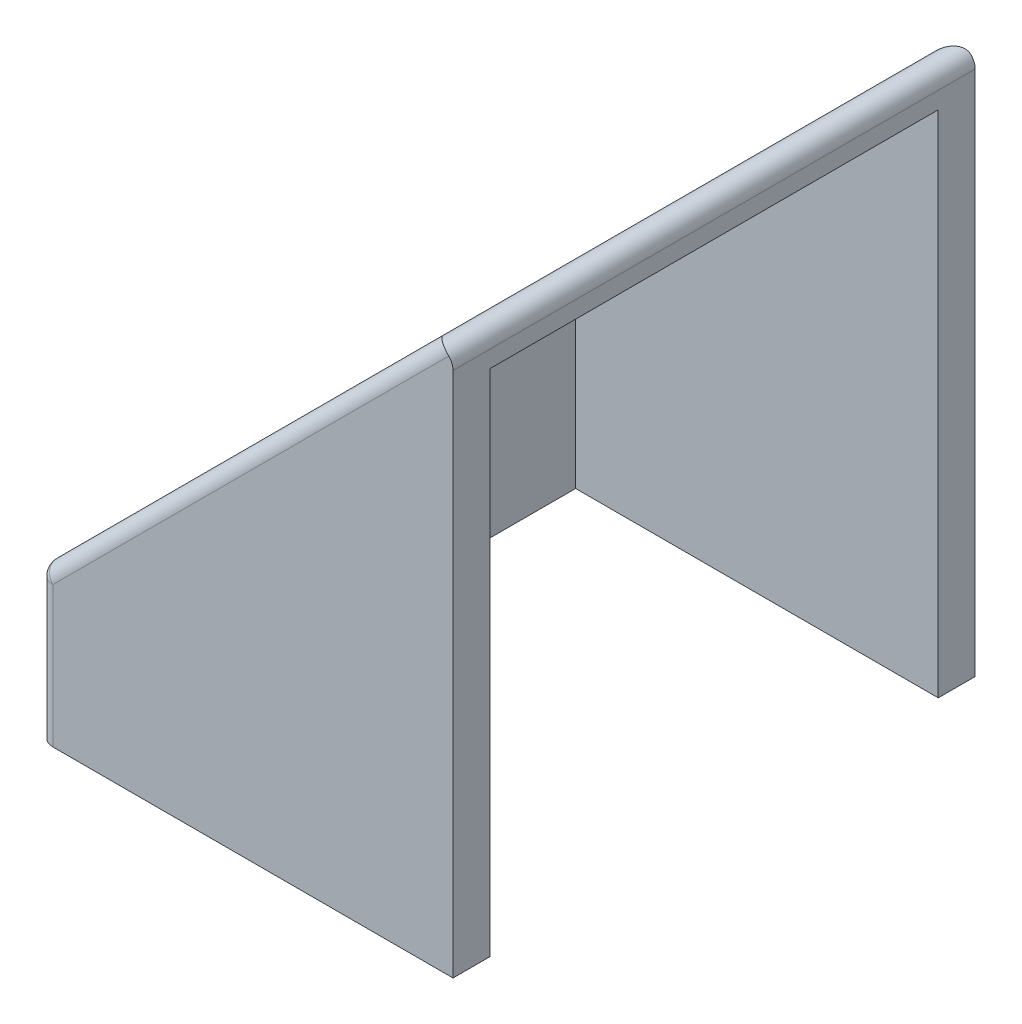
from build123d import *

# Parameters (mm, degrees)
BOSS_EXTRUDE1_DEPTH              = 22.606
CUT_EXTRUDE1_REACH               = 37.603
CUT_EXTRUDE1_OFFSET_FROM_SURFACE = 1.6
SKETCH2_W                        = 19.406
SKETCH2_H                        = 16.360512242
BOSS_EXTRUDE2_DEPTH              = 6.35
FILLET1_R                        = 0.635


with BuildPart() as part:
    # Sketch1 → Boss-Extrude1 (new body)
    with BuildSketch(Plane.XY):
        Polygon((0, 0), (17.960512242, 17.960512242), (17.960512242, 0), align=None)
    extrude(amount=BOSS_EXTRUDE1_DEPTH)

    # Cut-Extrude1: up to this face of the body (flat: up to its plane, moved by the offset)
    cut_extrude1_end = Plane(part.part.faces().sort_by_distance((8.980256121, 8.980256121, 11.303))[0]).offset(-CUT_EXTRUDE1_OFFSET_FROM_SURFACE)
    # Sketch2 → Cut-Extrude1 (cut, up to the picked face)
    with BuildSketch(Plane(origin=(17.960512242, 0, 0), x_dir=(0, 0, -1), z_dir=(1, 0, 0)), mode=Mode.PRIVATE) as cut_extrude1_sk1:
        with Locations((-11.303, 8.180256121)):
            Rectangle(SKETCH2_W, SKETCH2_H)
    cut_extrude1_tool1 = split(extrude(cut_extrude1_sk1.sketch, amount=-CUT_EXTRUDE1_REACH, mode=Mode.PRIVATE), bisect_by=cut_extrude1_end, keep=Keep.BOTH, mode=Mode.PRIVATE)
    add(cut_extrude1_tool1.solids().sort_by(Axis((17.960512, 8.180256, 11.303), (-1, 0, 0)))[0], mode=Mode.SUBTRACT)

    # Sketch3 → Boss-Extrude2 (add)
    with BuildSketch(Plane.XZ):
        Polygon((17.960512242, 22.606), (0, 22.606), (0, 0), (17.960512242, 0), (17.960512242, 1.6), (2.2627417, 1.6), (2.2627417, 21.006), (17.960512242, 21.006), align=None)
    extrude(amount=BOSS_EXTRUDE2_DEPTH)

    # Fillet1
    fillet1_edges = [part.edges().sort_by_distance(p)[0] for p in [
        (17.960512242, 17.960512242, 11.303),
        (0, 0, 11.303),
        (8.980256121, 8.980256121, 0),
        (8.980256121, 8.980256121, 22.606),
        (0, -3.175, 0),
        (0, -3.175, 22.606),
    ]]
    fillet(fillet1_edges, radius=FILLET1_R)


solid = part.part
